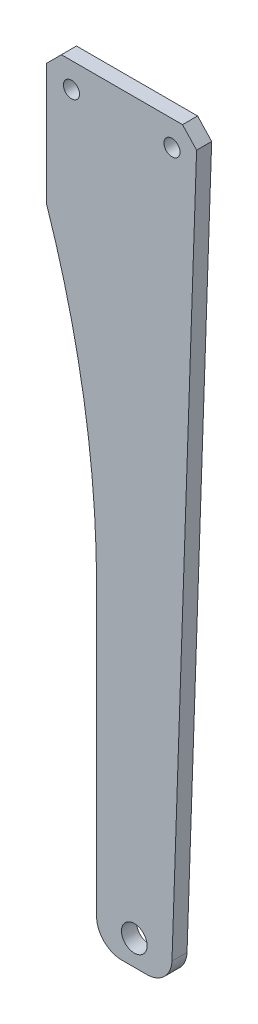
from build123d import *
from OCP.BRepFilletAPI import BRepFilletAPI_MakeChamfer

# Parameters (mm, degrees)
SKETCH_1_W          = 30
SKETCH_1_H          = 150
SKETCH_1_R          = 1.6
EXTRUDE_1_DEPTH     = 3
CUT_EXTRUDE_3_REACH = 149.17
SKETCH_4_W          = 5
SKETCH_4_H          = 55
CHAMFER_1_SIZE      = 2.5
CUT_EXTRUDE_4_REACH = 149.17
SKETCH_5_R          = 2.55
EXTRUDE_5_DEPTH     = 3
EXTRUDE_2_DEPTH     = 3
FILLET_2_R          = 65
FILLET_3_R          = 115
FILLET_4_R          = 5
CUT_EXTRUDE_START   = -3
CUT_EXTRUDE_6_DEPTH = 3
CHAMFER_2_SIZE      = 3
CHAMFER_2_SIZE2     = 2.901779002


# Read off the part's stored shape, not the designer's step: 切除-拉伸6
with BuildPart() as part:
    # 草图1 → 凸台-拉伸1 (new body)
    with BuildSketch(Plane.XY):
        with Locations((10, -70)):
            Rectangle(SKETCH_1_W, SKETCH_1_H)
        Circle(SKETCH_1_R, mode=Mode.SUBTRACT)
        with Locations((20, 0)):
            Circle(SKETCH_1_R, mode=Mode.SUBTRACT)
    extrude(amount=EXTRUDE_1_DEPTH)

    # 草图4 → 切除-拉伸3 (cut, up to next)
    with BuildSketch(Plane.XY.offset(3), mode=Mode.PRIVATE) as cut_extrude_3_sk1:
        with Locations((-2.5, -117.5)):
            Rectangle(SKETCH_4_W, SKETCH_4_H)
    cut_extrude_3_tool1 = extrude(cut_extrude_3_sk1.sketch, amount=-CUT_EXTRUDE_3_REACH, mode=Mode.PRIVATE) & part.part
    add(cut_extrude_3_tool1.solids().sort_by_distance((-2.5, -117.5, 3))[0], mode=Mode.SUBTRACT)

    # 倒角1
    chamfer_1_edges = [part.edges().sort_by_distance(p)[0] for p in [
        (-5, -90, 1.5),
    ]]
    chamfer(chamfer_1_edges, length=CHAMFER_1_SIZE)

    # 草图5 → 切除-拉伸4 (cut, up to next)
    with BuildSketch(Plane.XY.offset(3), mode=Mode.PRIVATE) as cut_extrude_4_sk1:
        with Locations((12.5, -140)):
            Circle(SKETCH_5_R)
    cut_extrude_4_tool1 = extrude(cut_extrude_4_sk1.sketch, amount=-CUT_EXTRUDE_4_REACH, mode=Mode.PRIVATE) & part.part
    add(cut_extrude_4_tool1.solids().sort_by_distance((12.5, -140, 3))[0], mode=Mode.SUBTRACT)

    # 草图9 → 凸台-拉伸5 (add)
    with BuildSketch(Plane(origin=(0, 0, 0), x_dir=(-1, 0, 0), z_dir=(0, 0, -1))):
        Polygon((5, -87.5), (0, -117.5), (0, -90), (2.5, -90), align=None)
    extrude(amount=-EXTRUDE_5_DEPTH)

    # 草图11 → 拉伸-薄壁2 (add)
    with BuildSketch(Plane.XY.offset(3)):
        Polygon((19.5, -67.916286439), (19.5, -61.710608008), (19.5, -3.420169007), (16.5, -3.420169007), (16.5, -61.710608008), (16.5, -67.916286439), align=None)
    extrude(amount=-EXTRUDE_2_DEPTH)

    # 圆角2
    fillet_2_edges = [part.edges().sort_by_distance(p)[0] for p in [
        (-5, -87.5, 1.5),
    ]]
    fillet(fillet_2_edges, radius=FILLET_2_R)

    # 圆角3
    fillet_3_edges = [part.edges().sort_by_distance(p)[0] for p in [
        (0, -117.5, 1.5),
    ]]
    fillet(fillet_3_edges, radius=FILLET_3_R)

    # 圆角4
    fillet_4_edges = [part.edges().sort_by_distance(p)[0] for p in [
        (0, -145, 1.5),
    ]]
    fillet(fillet_4_edges, radius=FILLET_4_R)

    # 切除-拉伸6 outline → 切除-拉伸6 (cut)
    with BuildSketch(Plane.XY.offset(3).offset(CUT_EXTRUDE_START)):
        with BuildLine():
            ThreePointArc((19.997033519, -140.172209208), (18.47411528, -143.595903644), (15, -145))
            Line((15, -145), (25, -145))
            Line((25, -145), (25, 5))
            Line((25, 5), (19.997033519, -140.172209208))
        make_face()
        with BuildLine():
            ThreePointArc((10, -145), (6.464466094, -143.535533906), (5, -140))
            Line((5, -140), (5, -83.1053734))
            ThreePointArc((5, -83.1053734), (2.483450387, -52.175255091), (-5, -22.058761091))
            Line((-5, -22.058761091), (-5, -82.120435531))
            ThreePointArc((-5, -82.120435531), (-4.778523942, -87.481670081), (-4.115605049, -92.806369705))
            Line((-4.115605049, -92.806369705), (-1.564698759, -108.111807444))
            ThreePointArc((-1.564698759, -108.111807444), (-0.391842257, -117.532429856), (0, -127.017690984))
            Line((0, -127.017690984), (0, -140))
            ThreePointArc((0, -140), (1.464466094, -143.535533906), (5, -145))
            Line((5, -145), (10, -145))
        make_face()
    extrude(amount=CUT_EXTRUDE_6_DEPTH, mode=Mode.SUBTRACT)

    # 倒角2: one chamfer whose edges measure the first distance from different faces: ONE call of the kernel's chamfer builder (chamfer() names one face for all edges)
    chamfer_2_edges_1 = [part.edges().sort_by_distance(p)[0] for p in [
        (-5, 5, 1.5),
    ]]
    chamfer_2_edges_2 = [part.edges().sort_by_distance(p)[0] for p in [
        (25, 5, 1.5),
    ]]
    chamfer_2_side_2 = [part.faces().sort_by_distance(p)[0] for p in [
        (22.498516759, -67.586104604, 1.5),
    ]]
    chamfer_2 = BRepFilletAPI_MakeChamfer(part.part.solid().wrapped)
    for e in chamfer_2_edges_1:
        chamfer_2.Add(CHAMFER_2_SIZE, e.wrapped)
    for e in chamfer_2_edges_2:
        chamfer_2.Add(CHAMFER_2_SIZE, CHAMFER_2_SIZE2, e.wrapped, chamfer_2_side_2[0].wrapped)  # the first distance lies on this face
    add(Compound.cast(chamfer_2.Shape()), mode=Mode.REPLACE)


solid = part.part
